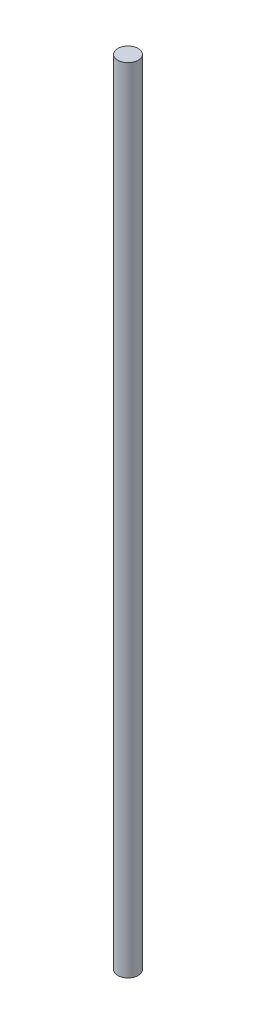
from build123d import *

# Parameters (mm, degrees)
SKETCH1_R           = 2
BOSS_EXTRUDE1_DEPTH = 155


with BuildPart() as part:
    # Sketch1 → Boss-Extrude1 (new body)
    with BuildSketch(Plane(origin=(0, 0, 0), x_dir=(1, 0, 0), z_dir=(0, 1, 0))):
        Circle(SKETCH1_R)
    extrude(amount=BOSS_EXTRUDE1_DEPTH)


solid = part.part
